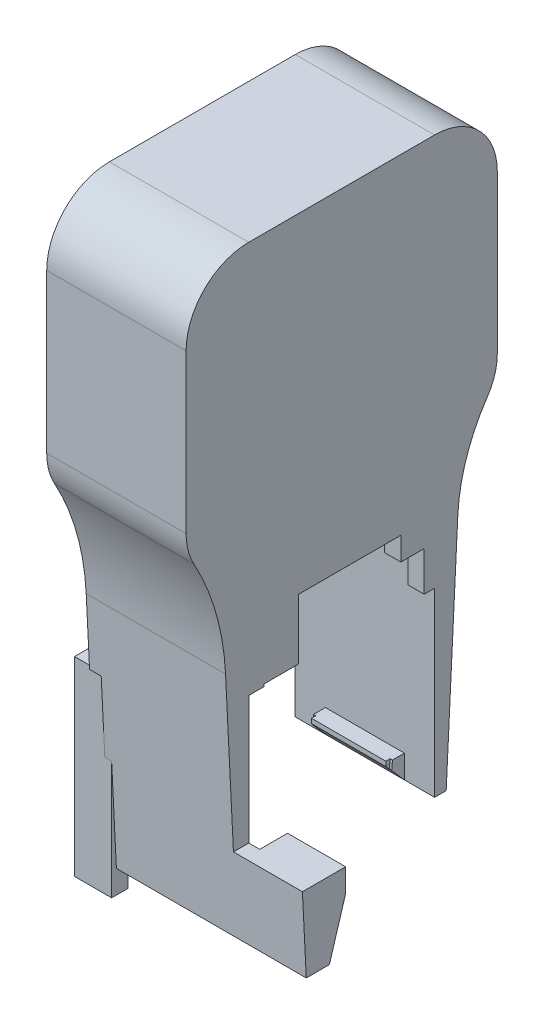
from build123d import *

# Parameters (mm, degrees)
BOSS_EXTRUDE1_DEPTH      = 3
BOSS_EXTRUDE2_DEPTH      = 0.7
BOSS_EXTRUDE3_START      = -5.3
BOSS_EXTRUDE3_DEPTH      = 0.7
BOSS_EXTRUDE4_DEPTH      = 1.7
BOSS_EXTRUDE5_DEPTH      = 2.97
BOSS_EXTRUDE6_DEPTH      = 2.5
BOSS_EXTRUDE7_DEPTH      = 0.805
BOSS_EXTRUDE7_DEPTH_BACK = 0.795
SKETCH7_W                = 0.7
SKETCH7_H                = 8.2
CUT_EXTRUDE2_DEPTH       = 0.5
CUT_EXTRUDE3_DEPTH       = 23.844830336
BOSS_EXTRUDE8_DEPTH      = 5.205
INDENT1_START            = -3
INDENT1_DEPTH            = 6
INDENT1_2_DEPTH          = 1.4
INDENT1_START_2          = 1.6
INDENT1_3_OUTLINE_W      = 0.1
INDENT1_3_OUTLINE_H      = 0.4
INDENT1_3_DEPTH          = 1.4
BOSS_EXTRUDE11_START     = 0.05
SKETCH14_W               = 1
SKETCH14_H               = 2
BOSS_EXTRUDE11_DEPTH     = 0.7
BOSS_EXTRUDE11_2_DEPTH   = 0.7
SKETCH15_W               = 1
SKETCH15_H               = 0.7
BOSS_EXTRUDE12_DEPTH     = 0.05
BOSS_EXTRUDE13_REACH     = 25.101
CUT_EXTRUDE4_REACH       = 18.211
SKETCH17_W               = 0.75
SKETCH17_H               = 1.6


# Read off the part's stored shape, not the designer's step: Indent1
with BuildPart() as part:
    # Sketch1 → Boss-Extrude1 (new, symmetric)
    with BuildSketch(Plane(origin=(0, 0, 0), x_dir=(0, 0, -1), z_dir=(1, 0, 0))):
        with BuildLine():
            Line((-4, 5.407024303), (4, 5.407024303))
            ThreePointArc((4, 5.407024303), (5.414213562, 4.821237865), (6, 3.407024303))
            Line((6, 3.407024303), (6, -3.407024303))
            ThreePointArc((6, -3.407024303), (5.881695242, -4.042569102), (5.54262919, -4.592975697))
            ThreePointArc((5.54262919, -4.592975697), (4.399020595, -6.449397799), (4, -8.592975697))
            Line((4, -8.592975697), (4, -18.592975697))
            Line((4, -18.592975697), (4.5, -18.592975697))
            Line((4.5, -18.592975697), (5, -8.592975697))
            ThreePointArc((5, -8.592975697), (5.375406184, -6.605461118), (6.273600288, -4.793172135))
            ThreePointArc((6.273600288, -4.793172135), (6.590990962, -4.132148866), (6.7, -3.407024303))
            Line((6.7, -3.407024303), (6.7, 3.407024303))
            ThreePointArc((6.7, 3.407024303), (5.909188309, 5.316212612), (4, 6.107024303))
            Line((4, 6.107024303), (-4, 6.107024303))
            ThreePointArc((-4, 6.107024303), (-5.909188309, 5.316212612), (-6.7, 3.407024303))
            Line((-6.7, 3.407024303), (-6.7, -3.407024303))
            ThreePointArc((-6.7, -3.407024303), (-6.614300123, -4.08188345), (-6.362640838, -4.7139016))
            ThreePointArc((-6.362640838, -4.7139016), (-5.407997914, -7.026917179), (-5, -9.495706737))
            Line((-5, -9.495706737), (-4.5, -19.495706737))
            Line((-4.5, -19.495706737), (-4, -19.495706737))
            Line((-4, -19.495706737), (-4, -9.495706737))
            ThreePointArc((-4, -9.495706737), (-4.412921237, -6.915479473), (-5.610440713, -4.592975697))
            ThreePointArc((-5.610440713, -4.592975697), (-5.900115974, -4.03117115), (-6, -3.407024303))
            Line((-6, -3.407024303), (-6, 3.407024303))
            ThreePointArc((-6, 3.407024303), (-5.414213562, 4.821237865), (-4, 5.407024303))
        make_face()
    extrude(amount=BOSS_EXTRUDE1_DEPTH, both=True)

    # Sketch2 → Boss-Extrude2 (add)
    with BuildSketch(Plane(origin=(3, 0, 0), x_dir=(0, 0, -1), z_dir=(1, 0, 0))):
        with BuildLine():
            Line((5, -8.592975697), (4.89, -10.792975697))
            Line((4.89, -10.792975697), (-4.935136552, -10.792975697))
            Line((-4.935136552, -10.792975697), (-5, -9.495706737))
            ThreePointArc((-5, -9.495706737), (-5.407997914, -7.026917179), (-6.362640838, -4.7139016))
            ThreePointArc((-6.362640838, -4.7139016), (-6.614300123, -4.08188345), (-6.7, -3.407024303))
            Line((-6.7, -3.407024303), (-6.7, 3.407024303))
            ThreePointArc((-6.7, 3.407024303), (-5.909188309, 5.316212612), (-4, 6.107024303))
            Line((-4, 6.107024303), (4, 6.107024303))
            ThreePointArc((4, 6.107024303), (5.909188309, 5.316212612), (6.7, 3.407024303))
            Line((6.7, 3.407024303), (6.7, -3.407024303))
            ThreePointArc((6.7, -3.407024303), (6.590990962, -4.132148866), (6.273600288, -4.793172135))
            ThreePointArc((6.273600288, -4.793172135), (5.375406184, -6.605461118), (5, -8.592975697))
        make_face()
    extrude(amount=-BOSS_EXTRUDE2_DEPTH)

    # Sketch2<2> → Boss-Extrude3 (add)
    with BuildSketch(Plane(origin=(3, 0, 0), x_dir=(0, 0, -1), z_dir=(1, 0, 0)).offset(BOSS_EXTRUDE3_START)):
        with BuildLine():
            Line((4.89, -10.792975697), (5, -8.592975697))
            ThreePointArc((5, -8.592975697), (5.375406184, -6.605461118), (6.273600288, -4.793172135))
            ThreePointArc((6.273600288, -4.793172135), (6.590990962, -4.132148866), (6.7, -3.407024303))
            Line((6.7, -3.407024303), (6.7, 3.407024303))
            ThreePointArc((6.7, 3.407024303), (5.909188309, 5.316212612), (4, 6.107024303))
            Line((4, 6.107024303), (-4, 6.107024303))
            ThreePointArc((-4, 6.107024303), (-5.909188309, 5.316212612), (-6.7, 3.407024303))
            Line((-6.7, 3.407024303), (-6.7, -3.407024303))
            ThreePointArc((-6.7, -3.407024303), (-6.614300123, -4.08188345), (-6.362640838, -4.7139016))
            ThreePointArc((-6.362640838, -4.7139016), (-5.407997914, -7.026917179), (-5, -9.495706737))
            Line((-5, -9.495706737), (-4.935136552, -10.792975697))
            Line((-4.935136552, -10.792975697), (-4, -10.792975697))
            Line((-4, -10.792975697), (-4, -9.495706737))
            ThreePointArc((-4, -9.495706737), (-4.412921237, -6.915479473), (-5.610440713, -4.592975697))
            ThreePointArc((-5.610440713, -4.592975697), (-5.900115974, -4.03117115), (-6, -3.407024303))
            Line((-6, -3.407024303), (-6, 3.407024303))
            ThreePointArc((-6, 3.407024303), (-5.414213562, 4.821237865), (-4, 5.407024303))
            Line((-4, 5.407024303), (4, 5.407024303))
            ThreePointArc((4, 5.407024303), (5.414213562, 4.821237865), (6, 3.407024303))
            Line((6, 3.407024303), (6, -3.407024303))
            ThreePointArc((6, -3.407024303), (5.881695242, -4.042569102), (5.54262919, -4.592975697))
            ThreePointArc((5.54262919, -4.592975697), (4.399020595, -6.449397799), (4, -8.592975697))
            Line((4, -8.592975697), (4, -10.792975697))
            Line((4, -10.792975697), (4.89, -10.792975697))
        make_face()
        Polygon((4.5, -18.592975697), (4.89, -10.792975697), (4, -10.792975697), (4, -18.592975697), align=None)
        with BuildLine():
            Line((-4, -10.792975697), (4, -10.792975697))
            Line((4, -10.792975697), (4, -8.592975697))
            ThreePointArc((4, -8.592975697), (4.399020595, -6.449397799), (5.54262919, -4.592975697))
            ThreePointArc((5.54262919, -4.592975697), (5.881695242, -4.042569102), (6, -3.407024303))
            Line((6, -3.407024303), (6, 3.407024303))
            ThreePointArc((6, 3.407024303), (5.414213562, 4.821237865), (4, 5.407024303))
            Line((4, 5.407024303), (-4, 5.407024303))
            ThreePointArc((-4, 5.407024303), (-5.414213562, 4.821237865), (-6, 3.407024303))
            Line((-6, 3.407024303), (-6, -3.407024303))
            ThreePointArc((-6, -3.407024303), (-5.900115974, -4.03117115), (-5.610440713, -4.592975697))
            ThreePointArc((-5.610440713, -4.592975697), (-4.412921237, -6.915479473), (-4, -9.495706737))
            Line((-4, -9.495706737), (-4, -10.792975697))
        make_face()
        Polygon((-4, -19.495706737), (-4, -10.792975697), (-4.935136552, -10.792975697), (-4.5, -19.495706737), align=None)
    extrude(amount=-BOSS_EXTRUDE3_DEPTH)

    # Sketch4 → Boss-Extrude4 (add, symmetric)
    with BuildSketch(Plane(origin=(0, 0, 0), x_dir=(0, 0, -1), z_dir=(1, 0, 0))):
        Polygon((3.3, -17.592975697), (4, -17.592975697), (4, -18.592975697), (3.3, -17.792975697), align=None)
    extrude(amount=BOSS_EXTRUDE4_DEPTH, both=True)

    # Sketch5 → Boss-Extrude5 (add)
    with BuildSketch(Plane(origin=(3, 0, 0), x_dir=(0, 0, -1), z_dir=(1, 0, 0))):
        Polygon((-4.495, -19.595706737), (-4.66, -16.295706737), (-4, -16.295706737), (-4, -19.595706737), align=None)
    extrude(amount=BOSS_EXTRUDE5_DEPTH)

    # Sketch6 → Boss-Extrude6 (add)
    with BuildSketch(Plane(origin=(5.97, 0, 0), x_dir=(0, 0, -1), z_dir=(1, 0, 0))):
        Polygon((-4.66, -16.295706737), (-1.51, -16.295706737), (-1.51, -17.795706737), (-3.5, -19.595706737), (-4.495, -19.595706737), align=None)
    extrude(amount=-BOSS_EXTRUDE6_DEPTH)

    # Sketch7 → Boss-Extrude7 (add, two sides: drawn at the far end of the back side and taken through both)
    with BuildSketch(Plane.ZY.offset(3).offset(-BOSS_EXTRUDE7_DEPTH_BACK)):
        with Locations((4.35, -16.492975697)):
            Rectangle(SKETCH7_W, SKETCH7_H)
    extrude(amount=BOSS_EXTRUDE7_DEPTH + BOSS_EXTRUDE7_DEPTH_BACK)

    # Sketch8 → Cut-Extrude2 (cut)
    with BuildSketch(Plane.ZY.offset(3)):
        Polygon((4.7, -15.495706737), (4.7, -12.392975697), (4.855136552, -12.392975697), align=None)
    extrude(amount=-CUT_EXTRUDE2_DEPTH, mode=Mode.SUBTRACT)

    # Sketch9 → Cut-Extrude3 (cut, through all)
    with BuildSketch(Plane.ZY.offset(-3.47)):
        Polygon((2.8, -16.295706737), (1.51, -16.295706737), (1.51, -17.795706737), (3.5, -19.595706737), (2.8, -17.295706737), align=None)
    extrude(amount=-CUT_EXTRUDE3_DEPTH, mode=Mode.SUBTRACT)

    # Sketch10 → Boss-Extrude8 (add)
    with BuildSketch(Plane.ZY.offset(-3)):
        Polygon((4.495, -19.595706737), (4.5, -19.495706737), (4, -19.495706737), (4, -19.595706737), align=None)
    extrude(amount=BOSS_EXTRUDE8_DEPTH)

    # Indent1 outline → Indent1 (cut)
    with BuildSketch(Plane.YZ.offset(INDENT1_START)):
        Polygon((-8.092975697, -2.55), (-8.092975697, 1.85), (-10.692975697, 1.85), (-10.692975697, 2.95), (-10.792975697, 2.95), (-10.792975697, -3.55), (-9.092975697, -3.55), (-9.092975697, -2.55), align=None)
    extrude(amount=INDENT1_DEPTH, mode=Mode.SUBTRACT)

    # Indent1 2 outline → Indent1 2 (cut)
    with BuildSketch(Plane.YZ.offset(INDENT1_START)):
        Polygon((-17.792975697, -3.3), (-17.968374126, -3.453473625), (-17.592975697, -3.487600755), (-17.592975697, -3.3), align=None)
        Polygon((-8.092975697, 2.35), (-9.092975697, 2.35), (-9.092975697, 2.95), (-10.692975697, 2.95), (-10.692975697, 1.85), (-8.092975697, 1.85), align=None)
    extrude(amount=INDENT1_2_DEPTH, mode=Mode.SUBTRACT)

    # Indent1 3 outline → Indent1 3 (cut)
    with BuildSketch(Plane.YZ.offset(INDENT1_START_2)):
        Polygon((-17.792975697, -3.3), (-17.968374126, -3.453473625), (-17.592975697, -3.487600755), (-17.592975697, -3.3), align=None)
        with Locations((-10.742975697, 3.15)):
            Rectangle(INDENT1_3_OUTLINE_W, INDENT1_3_OUTLINE_H)
    extrude(amount=INDENT1_3_DEPTH, mode=Mode.SUBTRACT)



with BuildPart() as body_2:
    # Sketch14 → Boss-Extrude11 (new body)
    with BuildSketch(Plane.ZY.offset(3).offset(BOSS_EXTRUDE11_START)):
        with Locations((1.2, -8.392975697)):
            Rectangle(SKETCH14_W, SKETCH14_H)
    extrude(amount=BOSS_EXTRUDE11_DEPTH)


with BuildPart() as body_3:
    # Sketch14 → Boss-Extrude11 2 (new body)
    with BuildSketch(Plane.ZY.offset(3).offset(BOSS_EXTRUDE11_START)):
        with Locations((-1.4, -8.392975697)):
            Rectangle(SKETCH14_W, SKETCH14_H)
    extrude(amount=BOSS_EXTRUDE11_2_DEPTH)


with BuildPart() as part_1:
    add(part.part)

    add(body_2.part)  # Boss-Extrude12 merges body 2

    add(body_3.part)  # Boss-Extrude12 merges body 3
    # Sketch15 → Boss-Extrude12 (add)
    with BuildSketch(Plane.ZY.offset(3)):
        with Locations((1.2, -7.742975697)):
            Rectangle(SKETCH15_W, SKETCH15_H)
        with Locations((-1.4, -7.742975697)):
            Rectangle(SKETCH15_W, SKETCH15_H)
    extrude(amount=BOSS_EXTRUDE12_DEPTH)

    # Boss-Extrude13: up to this face of the body (flat: up to its plane)
    boss_extrude13_end = Plane(part_1.part.faces().sort_by_distance((-3.390853659, -8.377122039, 1.7))[0])
    # Sketch16 → Boss-Extrude13 (add, up to the picked face)
    with BuildSketch(Plane(origin=(0, 0, -1.9), x_dir=(-1, 0, 0), z_dir=(0, 0, -1)), mode=Mode.PRIVATE) as boss_extrude13_sk1:
        Polygon((3, -7.392975697), (3, -6.642975697), (3.75, -7.392975697), align=None)
    boss_extrude13_tool1 = split(extrude(boss_extrude13_sk1.sketch, amount=-BOSS_EXTRUDE13_REACH, mode=Mode.PRIVATE), bisect_by=boss_extrude13_end, keep=Keep.BOTH, mode=Mode.PRIVATE)
    add(boss_extrude13_tool1.solids().sort_by(Axis((-3.25, -7.142976, -1.9), (0, 0, 1)))[0])

    # Cut-Extrude4: up to this face of the body (flat: up to its plane)
    cut_extrude4_end = Plane(part_1.part.faces().sort_by_distance((-3.375, -7.017975697, -0.1))[0])
    # Sketch17 → Cut-Extrude4 (cut, up to the picked face)
    with BuildSketch(Plane.XZ.offset(7.392975697), mode=Mode.PRIVATE) as cut_extrude4_sk1:
        with Locations((-3.375, -0.1)):
            Rectangle(SKETCH17_W, SKETCH17_H)
    cut_extrude4_tool1 = split(extrude(cut_extrude4_sk1.sketch, amount=-CUT_EXTRUDE4_REACH, mode=Mode.PRIVATE), bisect_by=cut_extrude4_end, keep=Keep.BOTH, mode=Mode.PRIVATE)
    add(cut_extrude4_tool1.solids().sort_by(Axis((-3.375, -7.392976, -0.1), (0, 1, 0)))[0], mode=Mode.SUBTRACT)


solid = part_1.part
